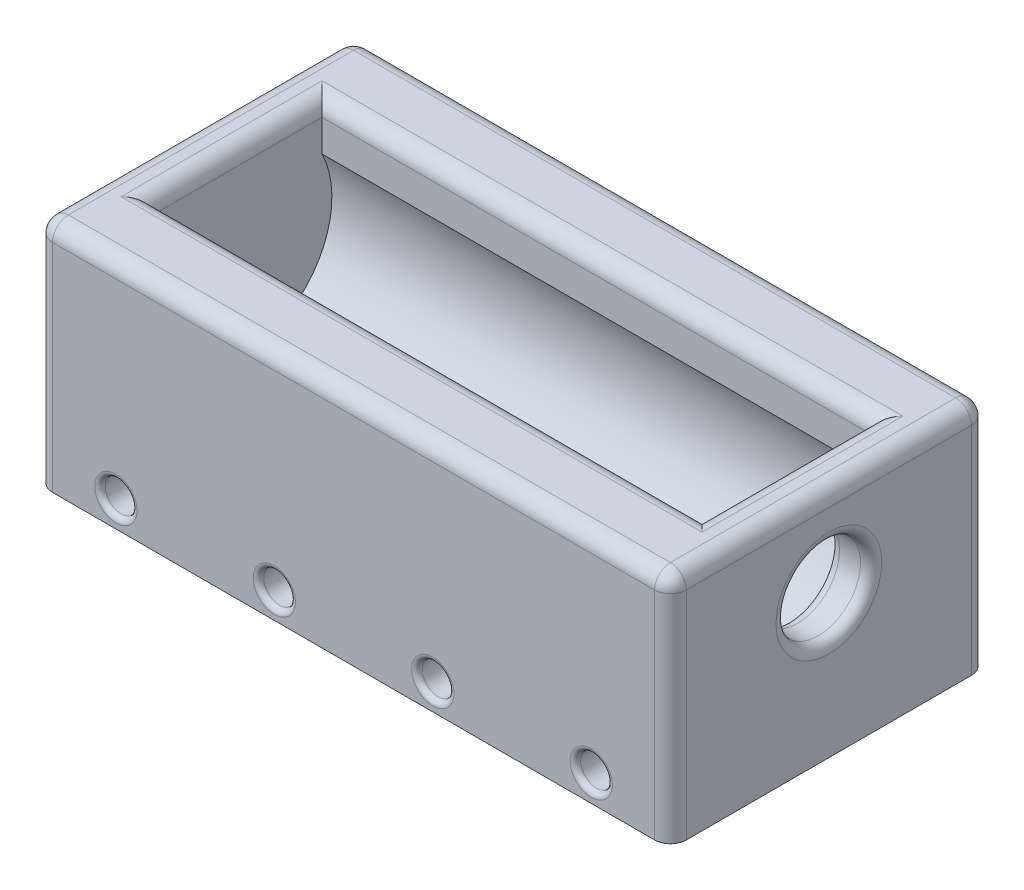
from build123d import *

# Parameters (mm, degrees)
SKETCH1_W               = 30
SKETCH1_H               = 15
BOSS_EXTRUDE1_DEPTH     = 6.75
CUT_EXTRUDE2_DEPTH      = 13
CUT_EXTRUDE2_DEPTH_BACK = 13
SKETCH4_R               = 2
CUT_EXTRUDE3_DEPTH      = 30.762602373
FILLET3_R               = 0.5
CUT_EXTRUDE4_DEPTH      = 32.651421769
CUT_EXTRUDE4_DEPTH_BACK = 32.651421769
SKETCH6_W               = 15
SKETCH6_H               = 2.5
FILLET6_R               = 0.75
SKETCH8_R               = 0.75
CUT_EXTRUDE5_DEPTH      = 23.261233119
FILLET9_R               = 0.75
FILLET10_R              = 0.25
SKETCH9_R               = 1.25
BOSS_EXTRUDE2_DEPTH     = 1
CHAMFER1_SIZE           = 1


with BuildPart() as part:
    # Sketch1 → Boss-Extrude1 (new, symmetric)
    with BuildSketch(Plane(origin=(0, 0, 0), x_dir=(1, 0, 0), z_dir=(0, 1, 0))):
        Rectangle(SKETCH1_W, SKETCH1_H)
    extrude(amount=BOSS_EXTRUDE1_DEPTH, both=True)

    # Sketch3 → Cut-Extrude2 (cut, two sides: drawn at the far end of the back side and taken through both)
    with BuildSketch(Plane(origin=(0, 0, 0), x_dir=(0, 0, -1), z_dir=(1, 0, 0)).offset(-CUT_EXTRUDE2_DEPTH_BACK)):
        with BuildLine():
            Line((4.003201844, 6.25), (-4.003201844, 6.25))
            Line((-4.003201844, 6.25), (-4.003201844, 2))
            ThreePointArc((-4.003201844, 2), (0, -4.475), (4.003201844, 2))
            Line((4.003201844, 2), (4.003201844, 6.25))
        make_face()
    extrude(amount=CUT_EXTRUDE2_DEPTH + CUT_EXTRUDE2_DEPTH_BACK, mode=Mode.SUBTRACT)

    # Sketch4 → Cut-Extrude3 (cut, through all)
    with BuildSketch(Plane.ZY.offset(-13)):
        Circle(SKETCH4_R)
    extrude(amount=-CUT_EXTRUDE3_DEPTH, mode=Mode.SUBTRACT)

    # Fillet3
    fillet3_edges = [part.edges().sort_by_distance(p)[0] for p in [
        (15, 0, -2),
        (13, 0, -2),
    ]]
    fillet(fillet3_edges, radius=FILLET3_R)

    # Sketch6 → Cut-Extrude4 (cut, two sides: drawn at the far end of the back side and taken through both)
    with BuildSketch(Plane(origin=(15, 0, 0), x_dir=(0, 0, -1), z_dir=(1, 0, 0)).offset(-CUT_EXTRUDE4_DEPTH_BACK)):
        with Locations((0, 5.5)):
            Rectangle(SKETCH6_W, SKETCH6_H)
    extrude(amount=CUT_EXTRUDE4_DEPTH + CUT_EXTRUDE4_DEPTH_BACK, mode=Mode.SUBTRACT)

    # Fillet6
    fillet6_edges = [part.edges().sort_by_distance(p)[0] for p in [
        (0, 4.25, 4.003201844),
        (0, 4.25, -4.003201844),
    ]]
    fillet(fillet6_edges, radius=FILLET6_R)

    # Sketch8 → Cut-Extrude5 (cut, through all)
    with BuildSketch(Plane(origin=(0, 0, -7.5), x_dir=(-1, 0, 0), z_dir=(0, 0, -1))):
        with Locations((-11.25, -5.5)):
            Circle(SKETCH8_R)
        with Locations(Location((-3.75, -5.5, 0), (0, 0, 180))):
            Circle(SKETCH8_R)
        with Locations((3.75, -5.5)):
            Circle(SKETCH8_R)
        with Locations(Location((11.25, -5.5, 0), (0, 0, 180))):
            Circle(SKETCH8_R)
    extrude(amount=-CUT_EXTRUDE5_DEPTH, mode=Mode.SUBTRACT)

    # Fillet9
    fillet9_edges = [part.edges().sort_by_distance(p)[0] for p in [
        (0, 4.25, 7.5),
        (-15, 4.25, 0),
        (-15, -1.25, 7.5),
        (-15, -1.25, -7.5),
        (15, 4.25, 0),
        (15, -1.25, 7.5),
        (0, 4.25, -7.5),
        (15, -1.25, -7.5),
        (13, 4.25, 0),
        (-13, 4.25, 0),
    ]]
    fillet(fillet9_edges, radius=FILLET9_R)

    # Fillet10
    fillet10_edges = [part.edges().sort_by_distance(p)[0] for p in [
        (-12, -5.5, 7.5),
        (-12, -5.5, -7.5),
        (12, -5.5, 7.5),
        (12, -5.5, -7.5),
        (3, -5.5, 7.5),
        (3, -5.5, -7.5),
        (-3, -5.5, 7.5),
        (-3, -5.5, -7.5),
    ]]
    fillet(fillet10_edges, radius=FILLET10_R)

    # Sketch9 → Boss-Extrude2 (add)
    with BuildSketch(Plane.XZ.offset(6.75)):
        with Locations(Location((-3.731931569, -3.767981789, 0), (0, 0, 90))):
            Circle(SKETCH9_R)
        with Locations(Location((-3.75, 3.75, 0), (0, 0, 90))):
            Circle(SKETCH9_R)
        with Locations(Location((3.731931569, -3.767981789, 0), (0, 0, 90))):
            Circle(SKETCH9_R)
        with Locations(Location((3.75, 3.75, 0), (0, 0, 90))):
            Circle(SKETCH9_R)
    extrude(amount=BOSS_EXTRUDE2_DEPTH)

    # Chamfer1
    chamfer1_edges = [part.edges().sort_by_distance(p)[0] for p in [
        (-3.731931569, -6.75, -5.017981789),
        (-3.75, -6.75, 2.5),
        (3.731931569, -6.75, -5.017981789),
        (3.75, -6.75, 2.5),
    ]]
    chamfer(chamfer1_edges, length=CHAMFER1_SIZE - 0.0001)  # a hair under: the kernel refuses the full size


solid = part.part
